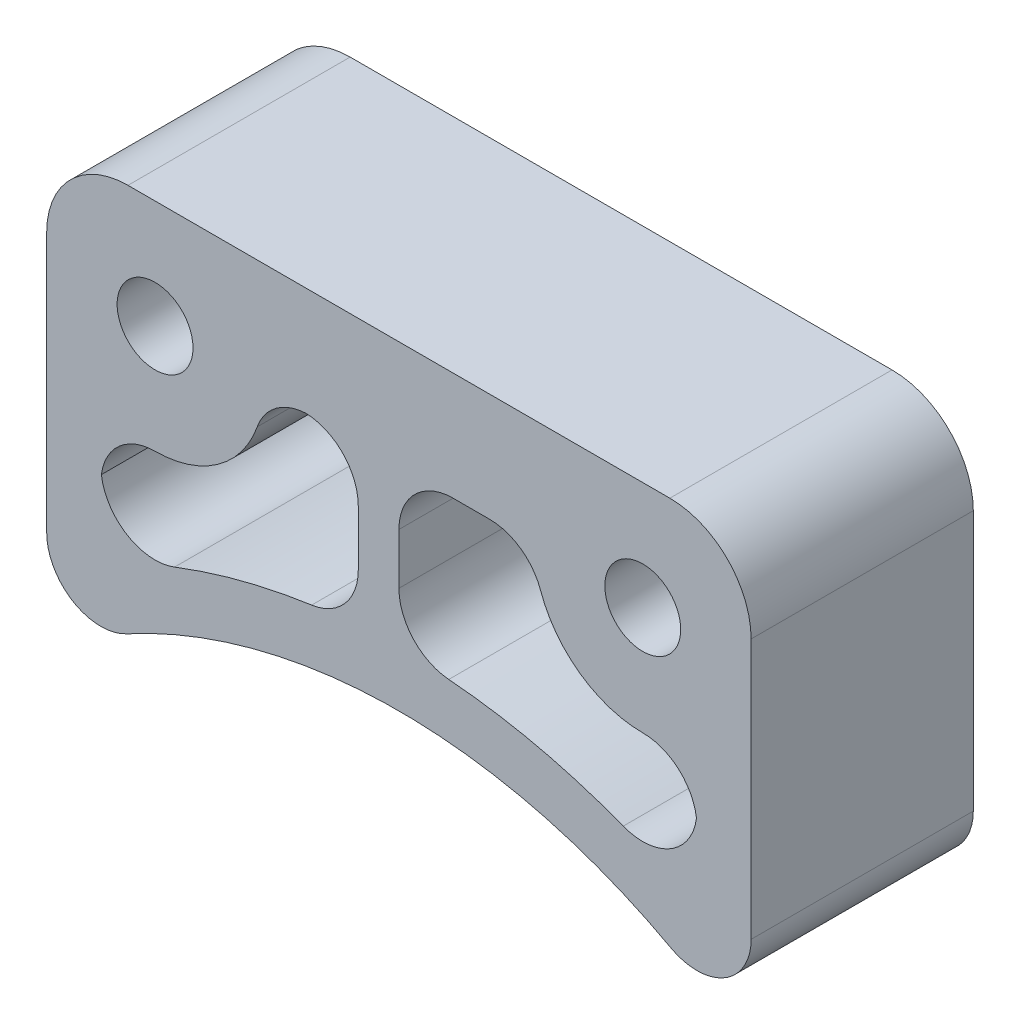
from build123d import *

# Parameters (mm, degrees)
SKETCH_1_R          = 1.4
EXTRUDE_1_DEPTH     = 8.2
CUT_EXTRUDE_1_DEPTH = 10
EXTRUDE_2_DEPTH     = 8.2
FILLET_1_R          = 2


with BuildPart() as part:
    # 草图1 → 凸台-拉伸1 (new body)
    with BuildSketch(Plane.XY):
        with BuildLine():
            Line((-13, 1), (-13, -12.307577498))
            ThreePointArc((-13, -12.307577498), (0, -7.8), (13, -12.307577498))
            Line((13, -12.307577498), (13, 1))
            ThreePointArc((13, 1), (12.121320344, 3.121320344), (10, 4))
            Line((10, 4), (-10, 4))
            ThreePointArc((-10, 4), (-12.121320344, 3.121320344), (-13, 1))
        make_face()
        with Locations((-9, 0)):
            Circle(SKETCH_1_R, mode=Mode.SUBTRACT)
        with Locations(Location((9, 0, 0), (0, 0, 180))):
            Circle(SKETCH_1_R, mode=Mode.SUBTRACT)
    extrude(amount=EXTRUDE_1_DEPTH)

    # 草图2 → 切除-拉伸1 (cut)
    with BuildSketch(Plane.XY.offset(8.2)):
        with BuildLine():
            ThreePointArc((-5, 0), (-7, -3.464101615), (-11, -3.464101615))
            Line((-11, -3.464101615), (-11, -8.600990123))
            ThreePointArc((-11, -8.600990123), (0, -5.8), (11, -8.600990123))
            Line((11, -8.600990123), (11, -3.464101615))
            ThreePointArc((11, -3.464101615), (7, -3.464101615), (5, 0))
            Line((5, 0), (-5, 0))
        make_face()
    extrude(amount=-CUT_EXTRUDE_1_DEPTH, mode=Mode.SUBTRACT)

    # 草图3 → 凸台-拉伸2 (add)
    with BuildSketch(Plane.XY.offset(8.2)):
        with BuildLine():
            Line((0, -5.8), (0, 0))
            Line((0, 0), (-1.5, 0))
            Line((-1.5, 0), (-1.5, -5.848965165))
            ThreePointArc((-1.5, -5.848965165), (-0.750399492, -5.812244551), (0, -5.8))
        make_face()
    extrude(amount=-EXTRUDE_2_DEPTH)

    # 圆角1
    # the kernel refuses this fillet: 2 mm, written as the material it adds along each edge
    with BuildSketch(Plane(origin=(-11, -8.600990123, 8.2), x_dir=(0, 1, 0), z_dir=(0, 0, -1))) as fillet_1_piece_1:
        with BuildLine():
            CenterArc((3.124797703, 2), FILLET_1_R, 158.899803976, 111.100196024)
            ThreePointArc((1.258893096, 2.72), (0.673800117, 1.339471911), (0, 0))
            Line((0, 0), (3.124797703, 0))
        make_face()
    extrude(amount=8.2)
    with BuildSketch(Plane(origin=(-11, -3.464101615, 8.2), x_dir=(0.9659258262890684, -0.2588190451025207, 0), z_dir=(0, 0, -1))) as fillet_1_piece_2:
        with BuildLine():
            CenterArc((2.588190451, 1.931851653), FILLET_1_R, 165, 90)
            Line((0.656338798, 2.449489743), (0, 0))
            ThreePointArc((0, 0), (1.03527618, 0.136296695), (2.070552361, 0))
        make_face()
    extrude(amount=8.2)
    with BuildSketch(Plane(origin=(-5, 0, 8.2), x_dir=(1, 0, 0), z_dir=(0, 0, -1))) as fillet_1_piece_3:
        with BuildLine():
            CenterArc((1.656854249, 2), FILLET_1_R, 199.471220634, 70.528779366)
            ThreePointArc((-0.228763834, 1.333333333), (-0.057605761, 0.676407915), (0, 0))
            Line((0, 0), (1.656854249, 0))
        make_face()
    extrude(amount=8.2)
    with BuildSketch(Plane(origin=(11, -3.464101615, 8.2), x_dir=(0, -1, 0), z_dir=(0, 0, -1))) as fillet_1_piece_4:
        with BuildLine():
            CenterArc((2.535898385, 2), FILLET_1_R, 180, 90)
            ThreePointArc((0.535898385, 2), (0.39960169, 0.96472382), (0, 0))
            Line((0, 0), (2.535898385, 0))
        make_face()
    extrude(amount=8.2)
    with BuildSketch(Plane(origin=(11, -8.600990123, 8.2), x_dir=(-0.9075134779972225, 0.42002296038833975, 0), z_dir=(0, 0, -1))) as fillet_1_piece_5:
        with BuildLine():
            CenterArc((3.127513738, 1.99575011), FILLET_1_R, 155.163962917, 111.100196024)
            Line((1.312486782, 2.835796031), (0, 0))
            ThreePointArc((0, 0), (1.498600333, 0.04887373), (2.997200665, 0))
        make_face()
    extrude(amount=8.2)
    with BuildSketch(Plane(origin=(5, 0, 8.2), x_dir=(-1, 0, 0), z_dir=(0, 0, -1))) as fillet_1_piece_6:
        with BuildLine():
            CenterArc((1.656854249, -2), FILLET_1_R, 90, 70.528779366)
            ThreePointArc((-0.228763834, -1.333333333), (-0.057605761, -0.676407915), (0, 0))
            Line((0, 0), (1.656854249, 0))
        make_face()
    extrude(amount=8.2)
    with BuildSketch(Plane(origin=(-1.5, 0, 8.2), x_dir=(-1, 0, 0), z_dir=(0, 0, -1))) as fillet_1_piece_7:
        with BuildLine():
            CenterArc((FILLET_1_R, -FILLET_1_R), FILLET_1_R, 90, 90)
            Line((0, -FILLET_1_R), (0, 0))
            Line((0, 0), (FILLET_1_R, 0))
        make_face()
    extrude(amount=8.2)
    with BuildSketch(Plane(origin=(-1.5, -5.848965165, 8.2), x_dir=(-0.994714309544396, -0.10268126600123115, 0), z_dir=(0, 0, -1))) as fillet_1_piece_8:
        with BuildLine():
            CenterArc((1.804319684, 1.998586493), FILLET_1_R, 185.893590739, 81.952153753)
            Line((-0.185108935, 1.793223961), (0, 0))
            ThreePointArc((0, 0), (0.864569849, 0.016255332), (1.729139697, 0))
        make_face()
    extrude(amount=8.2)
    with BuildSketch(Plane(origin=(0, -5.8, 8.2), x_dir=(0.9991983946019533, -0.04003208993893798, 0), z_dir=(0, 0, -1))) as fillet_1_piece_9:
        with BuildLine():
            CenterArc((1.921540317, -1.998396789), FILLET_1_R, 92.294282868, 85.411434264)
            Line((-0.076856472, -1.918332609), (0, 0))
            ThreePointArc((0, 0), (0.920738069, -0.018436924), (1.841476137, 0))
        make_face()
    extrude(amount=8.2)
    with BuildSketch(Plane(origin=(0, 0, 8.2), x_dir=(1, 0, 0), z_dir=(0, 0, -1))) as fillet_1_piece_10:
        with BuildLine():
            CenterArc((FILLET_1_R, FILLET_1_R), FILLET_1_R, 180, 90)
            Line((0, FILLET_1_R), (0, 0))
            Line((0, 0), (FILLET_1_R, 0))
        make_face()
    extrude(amount=8.2)
    # the kernel refuses this fillet: 2 mm, written as the material it takes off along each edge
    with BuildSketch(Plane(origin=(13, -12.307577498, -9.266468436), x_dir=(-0.8347589906571732, 0.5506154987984059, 0), z_dir=(0, 0, 1))) as fillet_1_2_piece_1:
        with BuildLine():
            CenterArc((3.710422437, -1.992876138), FILLET_1_R, 94.837370868, 118.571878142)
            Line((2.040904456, -3.094107135), (0, 0))
            ThreePointArc((0, 0), (1.770883436, -0.074800554), (3.541766872, 0))
        make_face()
    extrude(amount=26.732936871, mode=Mode.SUBTRACT)
    with BuildSketch(Plane(origin=(-13, -12.307577498, -9.266468436), x_dir=(0, 1, 0), z_dir=(0, 0, 1))) as fillet_1_2_piece_2:
        with BuildLine():
            CenterArc((3.706587374, -2), FILLET_1_R, 90, 118.571878142)
            ThreePointArc((1.950151733, -2.956521739), (1.037516301, -1.437074525), (0, 0))
            Line((0, 0), (3.706587374, 0))
        make_face()
    extrude(amount=26.732936871, mode=Mode.SUBTRACT)


solid = part.part
